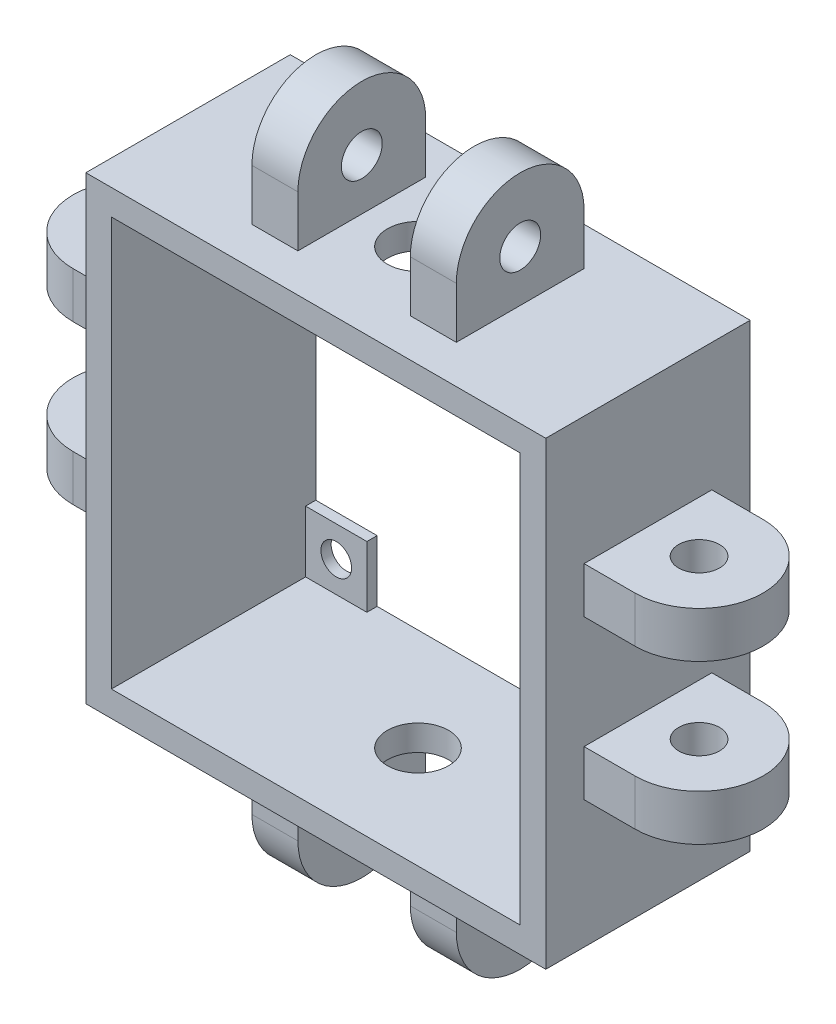
from build123d import *

# Parameters (mm, degrees)
SKETCH_1_W               = 90
SKETCH_1_H               = 90
SKETCH_1_W_2             = 80
SKETCH_1_H_2             = 80
EXTRUDE_1_DEPTH          = 40
SKETCH_3_R               = 6
CUT_EXTRUDE_2_DEPTH      = 109.282039139
SKETCH_4_R               = 4
EXTRUDE_2_DEPTH          = 20
SKETCH_5_W               = 22
SKETCH_5_H               = 30
CUT_EXTRUDE_3_DEPTH      = 88.392791465
PATTERN_CIRCULAR_3_COUNT = 4
SKETCH_6_W               = 12
SKETCH_6_H               = 12
EXTRUDE_3_DEPTH          = 2
CUT_EXTRUDE_4_REACH      = 105.501
SKETCH_7_R               = 3


with BuildPart() as part:
    # 草图1 → 凸台-拉伸1 (new body)
    with BuildSketch(Plane.XY):
        Rectangle(SKETCH_1_W, SKETCH_1_H)
        Rectangle(SKETCH_1_W_2, SKETCH_1_H_2, mode=Mode.SUBTRACT)
    extrude(amount=EXTRUDE_1_DEPTH)

    # 草图3 → 切除-拉伸2 (cut, through all)
    with BuildSketch(Plane(origin=(0, 45, 0), x_dir=(1, 0, 0), z_dir=(0, 1, 0))):
        with Locations((0, -20)):
            Circle(SKETCH_3_R)
    extrude(amount=-CUT_EXTRUDE_2_DEPTH, mode=Mode.SUBTRACT)

    # 草图4 → 凸台-拉伸2 (add, symmetric)
    with BuildSketch(Plane(origin=(0, -1.997656421, 74.265247584), x_dir=(0, 0, -1), z_dir=(1, 0, 0))):
        with BuildLine():
            Line((41.765247584, -43.002343579), (41.765247584, -53.002343579))
            ThreePointArc((41.765247584, -53.002343579), (54.265247584, -65.502343579), (66.765247584, -53.002343579))
            Line((66.765247584, -53.002343579), (66.765247584, -43.002343579))
            Line((66.765247584, -43.002343579), (41.765247584, -43.002343579))
        make_face()
        with Locations((54.265247584, -53.002343579)):
            Circle(SKETCH_4_R, mode=Mode.SUBTRACT)
    extrude_2 = extrude(amount=EXTRUDE_2_DEPTH, both=True)

    # 草图5 → 切除-拉伸3 (cut, through all)
    with BuildSketch(Plane(origin=(0, 0, 7.5), x_dir=(-1, 0, 0), z_dir=(0, 0, -1))):
        with Locations((0, -60)):
            Rectangle(SKETCH_5_W, SKETCH_5_H)
    cut_extrude_3 = extrude(amount=-CUT_EXTRUDE_3_DEPTH, mode=Mode.SUBTRACT)

    # 阵列(圆周)3: 凸台-拉伸2, 切除-拉伸3 ×4 about axis
    pattern_circular_3_axis = Axis((0, 0, 42), (0, 0, -1))
    add([extrude_2.rotate(pattern_circular_3_axis, i * 360 / PATTERN_CIRCULAR_3_COUNT) for i in range(1, PATTERN_CIRCULAR_3_COUNT)])
    add([cut_extrude_3.rotate(pattern_circular_3_axis, i * 360 / PATTERN_CIRCULAR_3_COUNT) for i in range(1, PATTERN_CIRCULAR_3_COUNT)], mode=Mode.SUBTRACT)

    # 草图6 → 凸台-拉伸3 (add)
    with BuildSketch(Plane(origin=(0, 0, 0), x_dir=(-1, 0, 0), z_dir=(0, 0, -1))):
        with Locations((-34, -34)):
            Rectangle(SKETCH_6_W, SKETCH_6_H)
        with Locations((34, -34)):
            Rectangle(SKETCH_6_W, SKETCH_6_H)
        with Locations((-34, 34)):
            Rectangle(SKETCH_6_W, SKETCH_6_H)
        with Locations((34, 34)):
            Rectangle(SKETCH_6_W, SKETCH_6_H)
    extrude(amount=-EXTRUDE_3_DEPTH)

    # 草图7 → 切除-拉伸4 (cut, up to next)
    with BuildSketch(Plane(origin=(0, 0, 0), x_dir=(-1, 0, 0), z_dir=(0, 0, -1)), mode=Mode.PRIVATE) as cut_extrude_4_sk1:
        with Locations((-34, 34)):
            Circle(SKETCH_7_R)
    cut_extrude_4_tool1 = extrude(cut_extrude_4_sk1.sketch, amount=-CUT_EXTRUDE_4_REACH, mode=Mode.PRIVATE) & part.part
    # 草图7 → 切除-拉伸4 (cut, up to next)
    with BuildSketch(Plane(origin=(0, 0, 0), x_dir=(-1, 0, 0), z_dir=(0, 0, -1)), mode=Mode.PRIVATE) as cut_extrude_4_sk2:
        with Locations((34, 34)):
            Circle(SKETCH_7_R)
    cut_extrude_4_tool2 = extrude(cut_extrude_4_sk2.sketch, amount=-CUT_EXTRUDE_4_REACH, mode=Mode.PRIVATE) & part.part
    # 草图7 → 切除-拉伸4 (cut, up to next)
    with BuildSketch(Plane(origin=(0, 0, 0), x_dir=(-1, 0, 0), z_dir=(0, 0, -1)), mode=Mode.PRIVATE) as cut_extrude_4_sk3:
        with Locations((34, -34)):
            Circle(SKETCH_7_R)
    cut_extrude_4_tool3 = extrude(cut_extrude_4_sk3.sketch, amount=-CUT_EXTRUDE_4_REACH, mode=Mode.PRIVATE) & part.part
    # 草图7 → 切除-拉伸4 (cut, up to next)
    with BuildSketch(Plane(origin=(0, 0, 0), x_dir=(-1, 0, 0), z_dir=(0, 0, -1)), mode=Mode.PRIVATE) as cut_extrude_4_sk4:
        with Locations((-34, -34)):
            Circle(SKETCH_7_R)
    cut_extrude_4_tool4 = extrude(cut_extrude_4_sk4.sketch, amount=-CUT_EXTRUDE_4_REACH, mode=Mode.PRIVATE) & part.part
    add(cut_extrude_4_tool1.solids().sort_by_distance((34, 34, 0))[0], mode=Mode.SUBTRACT)
    add(cut_extrude_4_tool2.solids().sort_by_distance((-34, 34, 0))[0], mode=Mode.SUBTRACT)
    add(cut_extrude_4_tool3.solids().sort_by_distance((-34, -34, 0))[0], mode=Mode.SUBTRACT)
    add(cut_extrude_4_tool4.solids().sort_by_distance((34, -34, 0))[0], mode=Mode.SUBTRACT)


solid = part.part
